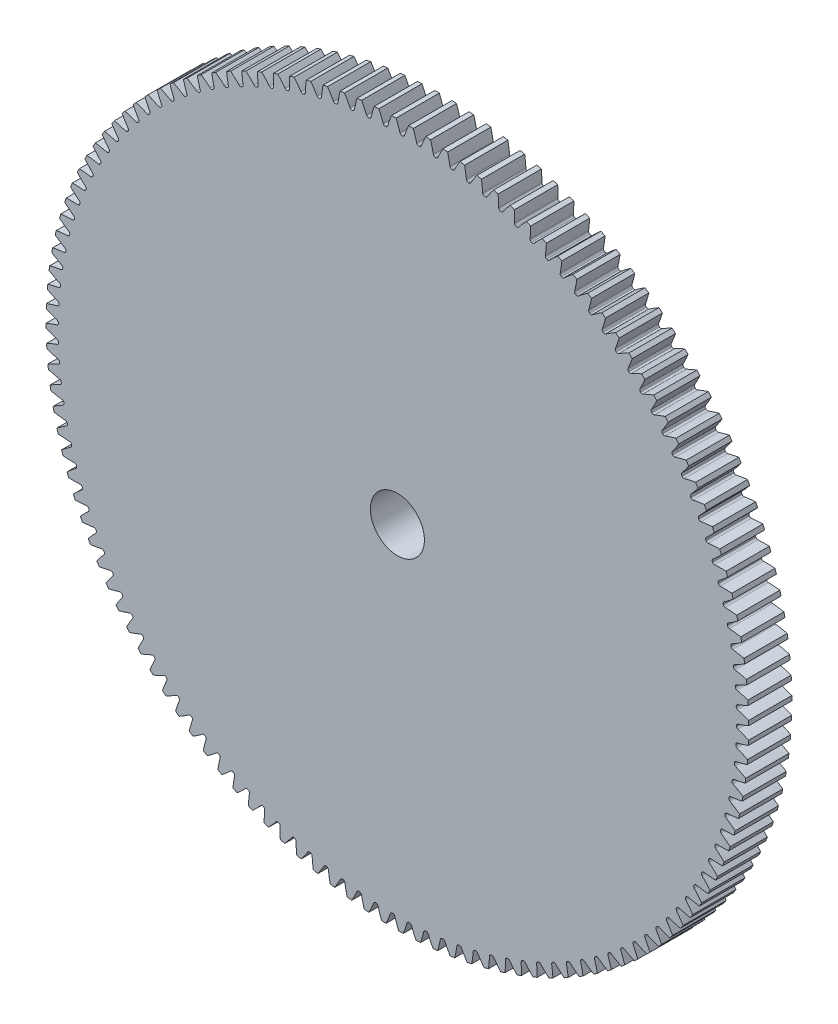
from build123d import *

# Parameters (mm, degrees)
SKETCH3_R                      = 51.59375
GEARBODY_DEPTH                 = 6.35
TOOTHCUT_DEPTH                 = 74.240375328
CIRPATTERN1_COUNT              = 128
BOREDIA_R                      = 1.5875
BORE_DEPTH                     = 12700
BOSS_EXTRUDE1_DEPTH            = 19.05
F_5_16_0_3125_DIAMETER_HOLE1_D = 7.9375


with BuildPart() as part:
    # Sketch3 → gearBody (new body)
    with BuildSketch(Plane.XY):
        Circle(SKETCH3_R)
    extrude(amount=GEARBODY_DEPTH)

    # Sketch2 → toothCut (cut, through all)
    with BuildSketch(Plane.XY):
        with BuildLine():
            ThreePointArc((49.791128573, -0.744880041), (49.791669175, -0.707821777), (49.792182195, -0.670763122))
            ThreePointArc((49.792182195, -0.670763122), (49.85206095, -0.493754461), (50.00423691, -0.385310888))
            ThreePointArc((50.00423691, -0.385310888), (55.775785838, 2.567286461), (60.26561802, 7.243825258))
            ThreePointArc((60.26561802, 7.243825258), (60.693272312, -0.862795335), (60.035355364, -8.953983809))
            ThreePointArc((60.035355364, -8.953983809), (55.680270843, -4.151708623), (49.994983452, -1.036244707))
            ThreePointArc((49.994983452, -1.036244707), (49.845951557, -0.923519263), (49.791128573, -0.744880041))
        make_face()
    toothcut = extrude(amount=TOOTHCUT_DEPTH, mode=Mode.SUBTRACT)

    # CirPattern1: toothCut ×128 about axis
    cirpattern1_axis = Axis((0, 0, 0), (0, 0, 1))
    for i in range(1, CIRPATTERN1_COUNT):
        add(toothcut.rotate(cirpattern1_axis, i * 360 / CIRPATTERN1_COUNT), mode=Mode.SUBTRACT)

    # boreDia → bore (cut, symmetric)
    with BuildSketch(Plane.XY):
        Circle(BOREDIA_R)
    extrude(amount=BORE_DEPTH, both=True, mode=Mode.SUBTRACT)

    # Sketch4 → Boss-Extrude1 (add)
    with BuildSketch(Plane(origin=(0, 0, 0), x_dir=(-1, 0, 0), z_dir=(0, 0, -1))):
        with BuildLine():
            ThreePointArc((-0.793738718, -8.16556784), (-0.707556317, -9.722715611), (-2e-09, -11.1125))
            ThreePointArc((-2e-09, -11.1125), (0.544212203, -11.099166154), (1.087118411, -11.059196617))
            ThreePointArc((1.087118411, -11.059196617), (1.655320364, -9.606859491), (1.588756053, -8.048749809))
            ThreePointArc((1.588756053, -8.048749809), (1.653196164, -7.581580176), (2.026164667, -7.292972328))
            ThreePointArc((2.026164667, -7.292972328), (2.314757883, -7.206572318), (2.599684553, -7.108757195))
            ThreePointArc((2.599684553, -7.108757195), (3.0709551, -7.126194658), (3.395386027, -7.468458545))
            ThreePointArc((3.395386027, -7.468458545), (4.24859606, -8.773896871), (5.556249998, -9.6237073))
            ThreePointArc((5.556249998, -9.6237073), (6.02088467, -9.340053749), (6.471070469, -9.03398601))
            ThreePointArc((6.471070469, -9.03398601), (6.236979233, -7.492124188), (5.400278009, -6.176043777))
            ThreePointArc((5.400278009, -6.176043777), (5.222499965, -5.739242951), (5.401196239, -5.302816972))
            ThreePointArc((5.401196239, -5.302816972), (5.607925289, -5.083695761), (5.805771462, -4.856522045))
            ThreePointArc((5.805771462, -4.856522045), (6.222622459, -4.635988057), (6.674719827, -4.770181814))
            ThreePointArc((6.674719827, -4.770181814), (8.066340554, -5.474119551), (9.623707298, -5.556250002))
            ThreePointArc((9.623707298, -5.556250002), (9.884265952, -5.078281485), (10.121104421, -4.588126147))
            ThreePointArc((10.121104421, -4.588126147), (9.147444552, -3.369880258), (7.764799831, -2.648471801))
            ThreePointArc((7.764799831, -2.648471801), (7.392439116, -2.359080211), (7.328981639, -1.89177609))
            ThreePointArc((7.328981639, -1.89177609), (7.398453644, -1.598647029), (7.456206597, -1.302985733))
            ThreePointArc((7.456206597, -1.302985733), (7.706943157, -0.903572198), (8.16556784, -0.793738718))
            ThreePointArc((8.16556784, -0.793738718), (9.722715611, -0.707556317), (11.1125, -2e-09))
            ThreePointArc((11.1125, -2e-09), (11.099166154, 0.544212203), (11.059196617, 1.087118411))
            ThreePointArc((11.059196617, 1.087118411), (9.606859491, 1.655320365), (8.048749811, 1.588756055))
            ThreePointArc((8.048749811, 1.588756055), (7.581580177, 1.653196165), (7.292972328, 2.026164667))
            ThreePointArc((7.292972328, 2.026164667), (7.206572318, 2.314757883), (7.108757195, 2.599684553))
            ThreePointArc((7.108757195, 2.599684553), (7.126194658, 3.0709551), (7.468458545, 3.395386026))
            ThreePointArc((7.468458545, 3.395386026), (8.773896871, 4.24859606), (9.6237073, 5.556249998))
            ThreePointArc((9.6237073, 5.556249998), (9.340053749, 6.02088467), (9.03398601, 6.471070469))
            ThreePointArc((9.03398601, 6.471070469), (7.492124188, 6.236979233), (6.176043777, 5.400278009))
            ThreePointArc((6.176043777, 5.400278009), (5.739242952, 5.222499965), (5.302816972, 5.401196238))
            ThreePointArc((5.302816972, 5.401196238), (5.08369576, 5.60792529), (4.856522043, 5.805771463))
            ThreePointArc((4.856522043, 5.805771463), (4.635988055, 6.222622461), (4.770181812, 6.674719828))
            ThreePointArc((4.770181812, 6.674719828), (5.474119549, 8.066340556), (5.55625, 9.6237073))
            ThreePointArc((5.55625, 9.6237073), (5.078281484, 9.884265953), (4.588126147, 10.121104421))
            ThreePointArc((4.588126147, 10.121104421), (3.369880258, 9.147444552), (2.648471801, 7.764799831))
            ThreePointArc((2.648471801, 7.764799831), (2.359080211, 7.392439116), (1.89177609, 7.328981639))
            ThreePointArc((1.89177609, 7.328981639), (1.598647029, 7.398453644), (1.302985733, 7.456206597))
            ThreePointArc((1.302985733, 7.456206597), (0.903572197, 7.706943157), (0.793738716, 8.165567841))
            ThreePointArc((0.793738716, 8.165567841), (0.707556315, 9.722715612), (0, 11.112500001))
            ThreePointArc((0, 11.112500001), (-0.544212204, 11.099166155), (-1.087118411, 11.059196618))
            ThreePointArc((-1.087118411, 11.059196618), (-1.655320366, 9.606859493), (-1.588756057, 8.048749812))
            ThreePointArc((-1.588756057, 8.048749812), (-1.653196166, 7.581580178), (-2.026164669, 7.292972329))
            ThreePointArc((-2.026164669, 7.292972329), (-2.314757885, 7.20657232), (-2.599684555, 7.108757197))
            ThreePointArc((-2.599684555, 7.108757197), (-3.070955102, 7.12619466), (-3.395386029, 7.468458547))
            ThreePointArc((-3.395386029, 7.468458547), (-4.248596062, 8.773896873), (-5.55625, 9.623707302))
            ThreePointArc((-5.55625, 9.623707302), (-6.020884671, 9.340053751), (-6.471070471, 9.033986012))
            ThreePointArc((-6.471070471, 9.033986012), (-6.236979234, 7.49212419), (-5.40027801, 6.176043779))
            ThreePointArc((-5.40027801, 6.176043779), (-5.222499966, 5.739242953), (-5.40119624, 5.302816973))
            ThreePointArc((-5.40119624, 5.302816973), (-5.607925292, 5.083695762), (-5.805771465, 4.856522044))
            ThreePointArc((-5.805771465, 4.856522044), (-6.222622462, 4.635988058), (-6.674719829, 4.770181815))
            ThreePointArc((-6.674719829, 4.770181815), (-8.066340556, 5.474119552), (-9.6237073, 5.556250003))
            ThreePointArc((-9.6237073, 5.556250003), (-9.884265953, 5.078281486), (-10.121104423, 4.588126148))
            ThreePointArc((-10.121104423, 4.588126148), (-9.147444554, 3.36988026), (-7.764799834, 2.648471803))
            ThreePointArc((-7.764799834, 2.648471803), (-7.392439117, 2.359080214), (-7.32898164, 1.891776091))
            ThreePointArc((-7.32898164, 1.891776091), (-7.398453645, 1.59864703), (-7.456206599, 1.302985733))
            ThreePointArc((-7.456206599, 1.302985733), (-7.706943158, 0.903572199), (-8.165567841, 0.793738718))
            ThreePointArc((-8.165567841, 0.793738718), (-9.722715612, 0.707556317), (-11.112500001, 2e-09))
            ThreePointArc((-11.112500001, 2e-09), (-11.099166155, -0.544212203), (-11.059196618, -1.087118411))
            ThreePointArc((-11.059196618, -1.087118411), (-9.606859492, -1.655320365), (-8.048749812, -1.588756055))
            ThreePointArc((-8.048749812, -1.588756055), (-7.581580178, -1.653196165), (-7.292972329, -2.026164667))
            ThreePointArc((-7.292972329, -2.026164667), (-7.206572319, -2.314757883), (-7.108757196, -2.599684553))
            ThreePointArc((-7.108757196, -2.599684553), (-7.126194659, -3.070955101), (-7.468458546, -3.395386027))
            ThreePointArc((-7.468458546, -3.395386027), (-8.773896873, -4.248596061), (-9.623707302, -5.556249998))
            ThreePointArc((-9.623707302, -5.556249998), (-9.34005375, -6.02088467), (-9.033986011, -6.47107047))
            ThreePointArc((-9.033986011, -6.47107047), (-7.492124189, -6.236979233), (-6.176043778, -5.40027801))
            ThreePointArc((-6.176043778, -5.40027801), (-5.739242952, -5.222499965), (-5.302816972, -5.401196239))
            ThreePointArc((-5.302816972, -5.401196239), (-5.083695762, -5.60792529), (-4.856522046, -5.805771463))
            ThreePointArc((-4.856522046, -5.805771463), (-4.635988057, -6.22262246), (-4.770181814, -6.674719827))
            ThreePointArc((-4.770181814, -6.674719827), (-5.474119551, -8.066340555), (-5.556250002, -9.623707298))
            ThreePointArc((-5.556250002, -9.623707298), (-5.078281485, -9.884265952), (-4.588126147, -10.121104421))
            ThreePointArc((-4.588126147, -10.121104421), (-3.369880259, -9.147444552), (-2.648471802, -7.764799832))
            ThreePointArc((-2.648471802, -7.764799832), (-2.359080213, -7.392439116), (-1.89177609, -7.328981639))
            ThreePointArc((-1.89177609, -7.328981639), (-1.59864703, -7.398453643), (-1.302985735, -7.456206597))
            ThreePointArc((-1.302985735, -7.456206597), (-0.903572199, -7.706943156), (-0.793738718, -8.16556784))
        make_face()
    extrude(amount=BOSS_EXTRUDE1_DEPTH)

    # 5/16 (0.3125) Diameter Hole1 (through all)
    with Locations(Plane(origin=(0, 0, -19.05), x_dir=(-1, 0, 0), z_dir=(0, 0, -1))):
        with Locations((0, 0)):
            Hole(F_5_16_0_3125_DIAMETER_HOLE1_D / 2)


solid = part.part
